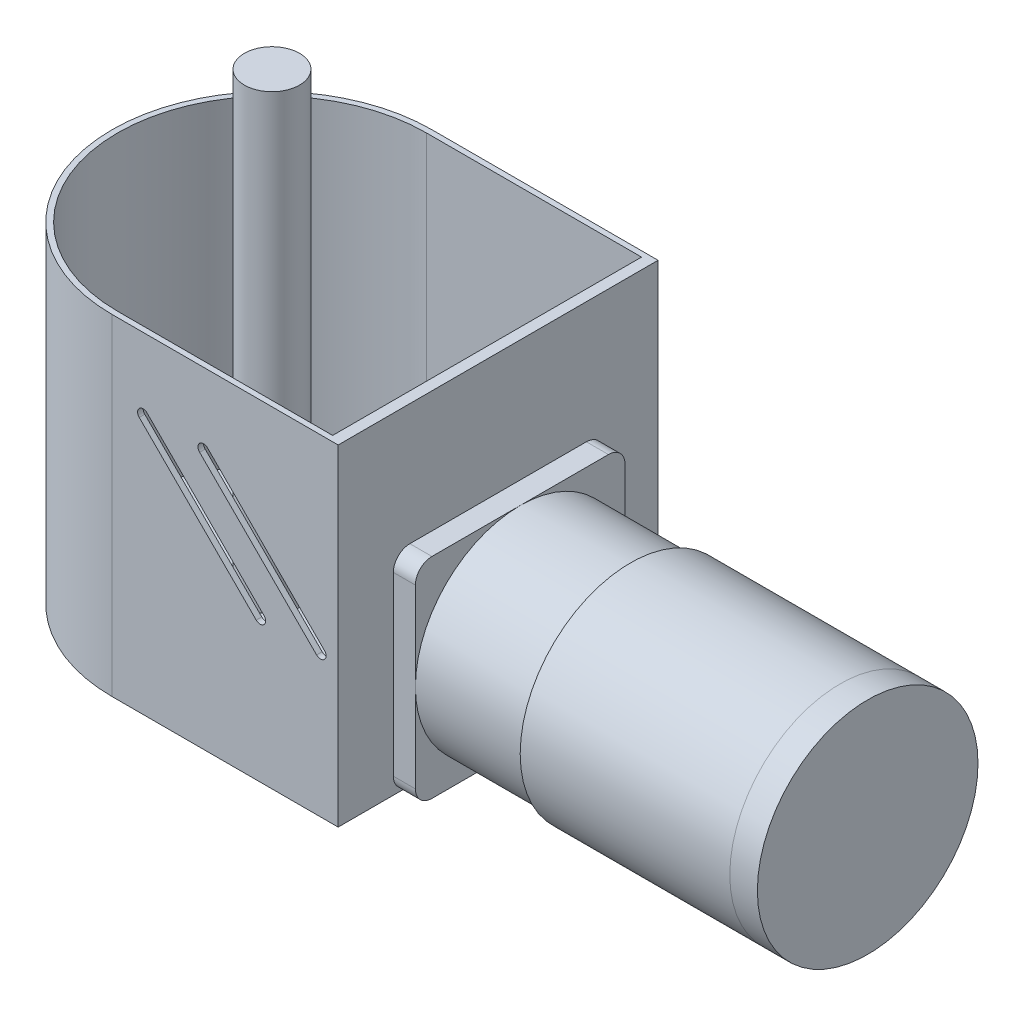
from build123d import *

# Parameters (mm, degrees)
SKETCH1_W            = 70
SKETCH1_H            = 58
BOSS_EXTRUDE1_DEPTH  = 60
FILLET2_R            = 29
CUT_EXTRUDE1_DEPTH   = 58
SKETCH3_W            = 38
SKETCH3_H            = 38
BOSS_EXTRUDE6_DEPTH  = 4
FILLET4_R            = 3
SKETCH7_R            = 19
BOSS_EXTRUDE7_DEPTH  = 20
SKETCH8_R            = 20
BOSS_EXTRUDE8_DEPTH  = 38
SKETCH9_R            = 20
BOSS_EXTRUDE9_DEPTH  = 5
CUT_EXTRUDE2_DEPTH   = 5
SKETCH11_R           = 5
BOSS_EXTRUDE10_DEPTH = 82


with BuildPart() as part:
    # Sketch1 → Boss-Extrude1 (new body)
    with BuildSketch(Plane(origin=(0, 0, 0), x_dir=(1, 0, 0), z_dir=(0, 1, 0))):
        with Locations((35, 29)):
            Rectangle(SKETCH1_W, SKETCH1_H)
    extrude(amount=BOSS_EXTRUDE1_DEPTH)

    # Fillet2
    fillet2_edges = [part.edges().sort_by_distance(p)[0] for p in [
        (0, 30, 0),
        (0, 30, -58),
    ]]
    fillet(fillet2_edges, radius=FILLET2_R - 0.0001)  # a hair under: the kernel refuses the full size

    # Sketch2 → Cut-Extrude1 (cut)
    with BuildSketch(Plane(origin=(0, 60, 0), x_dir=(1, 0, 0), z_dir=(0, 1, 0))):
        with BuildLine():
            Line((29, 57), (68, 57))
            Line((68, 57), (68, 1))
            Line((68, 1), (29, 1))
            ThreePointArc((29, 1), (1, 29), (29, 57))
        make_face()
    extrude(amount=-CUT_EXTRUDE1_DEPTH, mode=Mode.SUBTRACT)

    # Sketch3 → Boss-Extrude6 (add)
    with BuildSketch(Plane(origin=(70, 0, 0), x_dir=(0, 0, -1), z_dir=(1, 0, 0))):
        with Locations((29, 19)):
            Rectangle(SKETCH3_W, SKETCH3_H)
    extrude(amount=BOSS_EXTRUDE6_DEPTH)

    # Fillet4
    fillet4_edges = [part.edges().sort_by_distance(p)[0] for p in [
        (72, 38, -10),
        (72, 0, -10),
        (72, 0, -48),
        (72, 38, -48),
    ]]
    fillet(fillet4_edges, radius=FILLET4_R)

    # Sketch7 → Boss-Extrude7 (add)
    with BuildSketch(Plane(origin=(74, 0, 0), x_dir=(0, 0, -1), z_dir=(1, 0, 0))):
        with Locations((29, 19)):
            Circle(SKETCH7_R)
    extrude(amount=BOSS_EXTRUDE7_DEPTH)

    # Sketch8 → Boss-Extrude8 (add)
    with BuildSketch(Plane(origin=(94, 0, 0), x_dir=(0, 0, -1), z_dir=(1, 0, 0))):
        with Locations((29, 19)):
            Circle(SKETCH8_R)
    extrude(amount=BOSS_EXTRUDE8_DEPTH)

    # Sketch10 → Cut-Extrude2 (cut)
    with BuildSketch(Plane.XY):
        with BuildLine():
            Line((35.346901033, 47.707106781), (56.560104469, 26.493903346))
            ThreePointArc((56.560104469, 26.493903346), (56.560104469, 25.079689783), (55.145890906, 25.079689783))
            Line((55.145890906, 25.079689783), (33.932687471, 46.292893219))
            ThreePointArc((33.932687471, 46.292893219), (33.932687471, 47.707106781), (35.346901033, 47.707106781))
        make_face()
        with BuildLine():
            Line((46.299007, 47.707106781), (67.512210435, 26.493903346))
            ThreePointArc((67.512210435, 26.493903346), (67.512210435, 25.079689783), (66.097996873, 25.079689783))
            Line((66.097996873, 25.079689783), (44.884793437, 46.292893219))
            ThreePointArc((44.884793437, 46.292893219), (44.884793437, 47.707106781), (46.299007, 47.707106781))
        make_face()
    extrude(amount=-CUT_EXTRUDE2_DEPTH, mode=Mode.SUBTRACT)

    # Sketch11 → Boss-Extrude10 (add)
    with BuildSketch(Plane(origin=(0, 2, 0), x_dir=(1, 0, 0), z_dir=(0, 1, 0))):
        with Locations(Location((29, 29, 0), (0, 0, 270))):
            Circle(SKETCH11_R)
    extrude(amount=BOSS_EXTRUDE10_DEPTH)


with BuildPart() as body_2:
    # Sketch9 → Boss-Extrude9 (new body)
    with BuildSketch(Plane(origin=(132, 0, 0), x_dir=(0, 0, -1), z_dir=(1, 0, 0))):
        with Locations((29, 19)):
            Circle(SKETCH9_R)
    extrude(amount=BOSS_EXTRUDE9_DEPTH)


solid = Compound([part.part, body_2.part])
